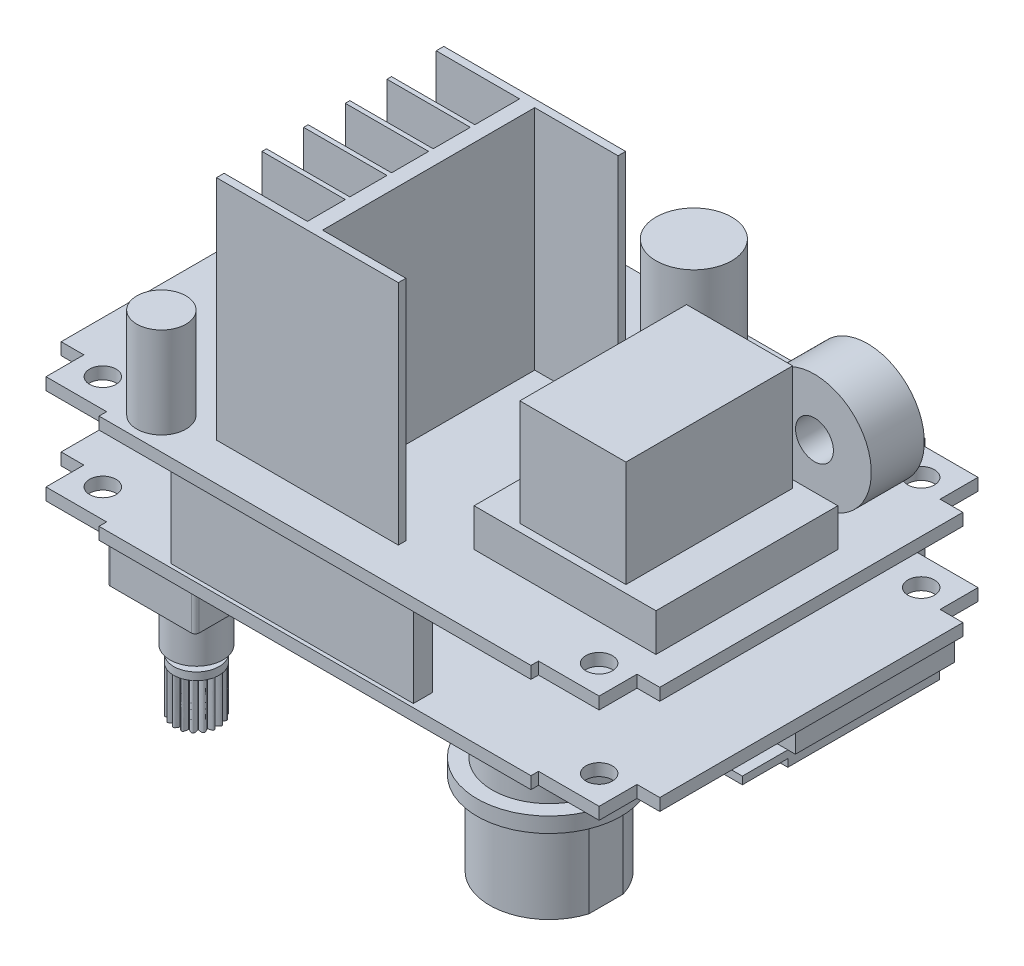
from build123d import *

# Parameters (mm, degrees)
SKETCH_1_R                   = 1.75
EXTRUDE_1_DEPTH              = 1.6
EXTRUDE_2_DEPTH              = 6.5
SKETCH_3_R                   = 3.5
EXTRUDE_3_DEPTH              = 7
SKETCH_4_R                   = 1.50317513
EXTRUDE_4_DEPTH              = 1
SKETCH_5_R                   = 3
EXTRUDE_5_DEPTH              = 1
EXTRUDE_6_DEPTH              = 6
PATTERN_CIRCULAR_2_COUNT     = 18
EXTRUDE_7_DEPTH              = 5
SKETCH_8_R                   = 7.5
EXTRUDE_8_DEPTH              = 4
SKETCH_9_R                   = 9.5
EXTRUDE_9_DEPTH              = 2
SKETCH_10_R                  = 6.35
EXTRUDE_10_DEPTH             = 11
EXTRUDE_11_DEPTH             = 3
SKETCH_12_W                  = 68.5
SKETCH_12_H                  = 26
EXTRUDE_12_DEPTH             = 1
SKETCH_13_W                  = 68.5
SKETCH_13_H                  = 20
EXTRUDE_13_DEPTH             = 1
SKETCH_14_W                  = 51
SKETCH_14_H                  = 2.54
SKETCH_14_W_2                = 32
EXTRUDE_14_DEPTH             = 11
SKETCH_15_R                  = 1.75
EXTRUDE_15_DEPTH             = 1.6
SKETCH_16_R                  = 3.24
EXTRUDE_16_DEPTH             = 12
EXTRUDE_17_DEPTH             = 30
PATTERN_START                = -2.1
PATTERN_LINEAR_1_OUTLINE_W   = 11
PATTERN_LINEAR_1_OUTLINE_H   = 30
PATTERN_LINEAR_1_DEPTH       = 0.6
PATTERN_START_2              = 3.4
PATTERN_LINEAR_1_2_OUTLINE_W = 11
PATTERN_LINEAR_1_2_OUTLINE_H = 30
PATTERN_LINEAR_1_2_DEPTH     = 0.6
PATTERN_START_3              = 8.9
PATTERN_LINEAR_1_3_OUTLINE_W = 11
PATTERN_LINEAR_1_3_OUTLINE_H = 30
PATTERN_LINEAR_1_3_DEPTH     = 0.6
SKETCH_18_R                  = 5
EXTRUDE_18_DEPTH             = 17
SKETCH_19_W                  = 8
SKETCH_19_H                  = 12
EXTRUDE_19_DEPTH             = 3
SKETCH_20_W                  = 1
SKETCH_20_H                  = 9
EXTRUDE_20_DEPTH             = 6
SKETCH_21_W                  = 1
SKETCH_21_H                  = 1
EXTRUDE_21_DEPTH             = 7
SKETCH_22_R                  = 7.5
SKETCH_22_R_2                = 2.5
EXTRUDE_22_DEPTH             = 3.5
SKETCH_23_W                  = 24
SKETCH_23_H                  = 24
EXTRUDE_23_DEPTH             = 5
SKETCH_24_W                  = 14
SKETCH_24_H                  = 22
EXTRUDE_24_DEPTH             = 14


# Read off the part's stored shape, not the designer's step: 阵列(线性)1
with BuildPart() as part:
    # 草图1 → 凸台-拉伸1 (new body)
    with BuildSketch(Plane(origin=(0, 0, 0), x_dir=(1, 0, 0), z_dir=(0, 1, 0))):
        Polygon((39.5, 20), (39.5, -20), (36.5, -20), (36.5, -25), (28.5, -25), (28.5, -26), (-28.5, -26), (-28.5, -25), (-36.5, -25), (-36.5, -20), (-39.5, -20), (-39.5, 20), (-36.5, 20), (-36.5, 25), (-28.5, 25), (-28.5, 26), (28.5, 26), (28.5, 25), (36.5, 25), (36.5, 20), align=None)
        with Locations(Location((32.75, -21.25, 0), (0, 0, 270))):
            Circle(SKETCH_1_R, mode=Mode.SUBTRACT)
        with Locations(Location((-32.75, -21.25, 0), (0, 0, 90))):
            Circle(SKETCH_1_R, mode=Mode.SUBTRACT)
        with Locations(Location((-32.75, 21.25, 0), (0, 0, 270))):
            Circle(SKETCH_1_R, mode=Mode.SUBTRACT)
        with Locations(Location((32.75, 21.25, 0), (0, 0, 90))):
            Circle(SKETCH_1_R, mode=Mode.SUBTRACT)
    extrude(amount=EXTRUDE_1_DEPTH)

    # 草图2 → 凸台-拉伸2 (add)
    with BuildSketch(Plane.XZ):
        with BuildLine():
            Line((-18.3, 12), (-29, 12))
            ThreePointArc((-29, 12), (-29.353553391, 12.146446609), (-29.5, 12.5))
            Line((-29.5, 12.5), (-29.5, 23.5))
            ThreePointArc((-29.5, 23.5), (-29.353553391, 23.853553391), (-29, 24))
            Line((-29, 24), (-18.3, 24))
            ThreePointArc((-18.3, 24), (-17.946446609, 23.853553391), (-17.8, 23.5))
            Line((-17.8, 23.5), (-17.8, 12.5))
            ThreePointArc((-17.8, 12.5), (-17.946446609, 12.146446609), (-18.3, 12))
        make_face()
    extrude(amount=EXTRUDE_2_DEPTH)

    # 草图3 → 凸台-拉伸3 (add)
    with BuildSketch(Plane.XZ.offset(6.5)):
        with Locations(Location((-23.65, 18, 0), (0, 0, 270))):
            Circle(SKETCH_3_R)
    extrude(amount=EXTRUDE_3_DEPTH)

    # 草图4 → 凸台-拉伸4 (add)
    with BuildSketch(Plane.XZ.offset(13.5)):
        with Locations(Location((-23.65, 18, 0), (0, 0, 270))):
            Circle(SKETCH_4_R)
    extrude(amount=EXTRUDE_4_DEPTH)

    # 草图5 → 凸台-拉伸5 (add)
    with BuildSketch(Plane.XZ.offset(14.5)):
        with Locations(Location((-23.65, 18, 0), (0, 0, 270))):
            Circle(SKETCH_5_R)
    extrude(amount=EXTRUDE_5_DEPTH)

    # 草图6 → 凸台-拉伸6 (add)
    with BuildSketch(Plane(origin=(0, -15.5, 0), x_dir=(-1, 0, 0), z_dir=(0, -1, 0))):
        with BuildLine():
            ThreePointArc((23.195961321, -15.541575936), (23.706262098, -20.499366835), (23.992953916, -15.523635202))
            add(Edge.make_bspline(
                [(23.195961321, -15.541575936), (23.545027306, -14.469277331), (23.992953916, -15.523635202)],
                knots=[0, 0, 0, 1, 1, 1], degree=2))
        make_face()
    extrude_6 = extrude(amount=EXTRUDE_6_DEPTH)

    # 阵列(圆周)2: 凸台-拉伸6 ×18 about axis
    pattern_circular_2_axis = Axis((-23.65, -21.5, 18), (0, 1, 0))
    for i in range(1, PATTERN_CIRCULAR_2_COUNT):
        add(extrude_6.rotate(pattern_circular_2_axis, i * 360 / PATTERN_CIRCULAR_2_COUNT))

    # 草图7 → 凸台-拉伸7 (add)
    with BuildSketch(Plane.XZ):
        with BuildLine():
            Line((0.95, 12.75), (-1.261126395, 12.75))
            ThreePointArc((-1.261126395, 12.75), (-10.05, 15.25), (-1.261126395, 17.75))
            Line((-1.261126395, 17.75), (0.95, 17.75))
            Line((0.95, 17.75), (0.95, 12.75))
        make_face()
    extrude(amount=EXTRUDE_7_DEPTH)

    # 草图8 → 凸台-拉伸8 (add)
    with BuildSketch(Plane.XZ):
        with Locations(Location((22, 17.1, 0), (0, 0, 90))):
            Circle(SKETCH_8_R)
    extrude(amount=EXTRUDE_8_DEPTH)

    # 草图9 → 凸台-拉伸9 (add)
    with BuildSketch(Plane.XZ.offset(4)):
        with Locations(Location((22, 17.1, 0), (0, 0, 270))):
            Circle(SKETCH_9_R)
    extrude(amount=EXTRUDE_9_DEPTH)

    # 草图10 → 凸台-拉伸10 (add)
    with BuildSketch(Plane.XZ.offset(6)):
        with BuildLine():
            Line((29.520638271, 14.85), (29.520638271, 19.35))
            ThreePointArc((29.520638271, 19.35), (22, 24.95), (14.479361729, 19.35))
            Line((14.479361729, 19.35), (14.479361729, 14.85))
            ThreePointArc((14.479361729, 14.85), (22, 9.25), (29.520638271, 14.85))
        make_face()
        with Locations(Location((22, 17.1, 0), (0, 0, 270))):
            Circle(SKETCH_10_R, mode=Mode.SUBTRACT)
    extrude(amount=EXTRUDE_10_DEPTH)

    # 草图11 → 凸台-拉伸11 (add)
    with BuildSketch(Plane.XZ):
        Polygon((-31.9, -3.613248654), (-31.9, 1.5), (38.9, 1.5), (38.9, -19.5), (-31.9, -19.5), (-31.9, -14.386751346), (-36.9, -11.5), (-36.9, -6.5), align=None)
    extrude(amount=EXTRUDE_11_DEPTH)

    # 草图12 → 凸台-拉伸12 (add)
    with BuildSketch(Plane(origin=(0, -3, 0), x_dir=(-1, 0, 0), z_dir=(0, -1, 0))):
        with Locations((-3.65, 5.5)):
            Rectangle(SKETCH_12_W, SKETCH_12_H)
    extrude(amount=EXTRUDE_12_DEPTH)

    # 草图13 → 凸台-拉伸13 (add)
    with BuildSketch(Plane.XZ.offset(4)):
        with Locations((3.65, -8.5)):
            Rectangle(SKETCH_13_W, SKETCH_13_H)
    extrude(amount=EXTRUDE_13_DEPTH)

    # 草图14 → 凸台-拉伸14 (add)
    with BuildSketch(Plane(origin=(0, 1.6, 0), x_dir=(1, 0, 0), z_dir=(0, 1, 0))):
        with Locations((-0.117965809, 24.282680859)):
            Rectangle(SKETCH_14_W, SKETCH_14_H)
        with Locations((-3.50214503, -24.242041787)):
            Rectangle(SKETCH_14_W_2, SKETCH_14_H)
    extrude(amount=EXTRUDE_14_DEPTH)

    # 草图15 → 凸台-拉伸15 (add)
    with BuildSketch(Plane(origin=(0, 12.6, 0), x_dir=(1, 0, 0), z_dir=(0, 1, 0))):
        Polygon((28.5, -25), (36.5, -25), (36.5, -20), (39.5, -20), (39.5, 20), (36.5, 20), (36.5, 25), (28.5, 25), (28.5, 26), (-28.5, 26), (-28.5, 25), (-36.5, 25), (-36.5, 20), (-39.5, 20), (-39.5, -20), (-36.5, -20), (-36.5, -25), (-28.5, -25), (-28.5, -26), (28.5, -26), align=None)
        with Locations(Location((-32.75, -21.25, 0), (0, 0, 90))):
            Circle(SKETCH_15_R, mode=Mode.SUBTRACT)
        with Locations(Location((32.75, -21.25, 0), (0, 0, 270))):
            Circle(SKETCH_15_R, mode=Mode.SUBTRACT)
        with Locations(Location((32.75, 21.25, 0), (0, 0, 90))):
            Circle(SKETCH_15_R, mode=Mode.SUBTRACT)
        with Locations(Location((-32.75, 21.25, 0), (0, 0, 270))):
            Circle(SKETCH_15_R, mode=Mode.SUBTRACT)
    extrude(amount=EXTRUDE_15_DEPTH)

    # 草图16 → 凸台-拉伸16 (add)
    with BuildSketch(Plane(origin=(0, 14.2, 0), x_dir=(1, 0, 0), z_dir=(0, 1, 0))):
        with Locations(Location((-24.51, -21.76, 0), (0, 0, 90))):
            Circle(SKETCH_16_R)
        with Locations(Location((-24.51, -3.76, 0), (0, 0, 90))):
            Circle(SKETCH_16_R)
    extrude(amount=EXTRUDE_16_DEPTH)

    # 草图17 → 凸台-拉伸17 (add)
    with BuildSketch(Plane(origin=(0, 14.2, 0), x_dir=(1, 0, 0), z_dir=(0, 1, 0))):
        Polygon((-18, -20), (-18, -21), (-7, -21), (-5, -21), (6, -21), (6, -20), (-5, -20), (-5, 8), (6, 8), (6, 9), (-5, 9), (-7, 9), (-18, 9), (-18, 8), (-7, 8), (-7, -14.4), (-18, -14.4), (-18, -15), (-7, -15), (-7, -20), align=None)
    extrude(amount=EXTRUDE_17_DEPTH)

    # 阵列(线性)1 outline → 阵列(线性)1 (add)
    with BuildSketch(Plane.XY.offset(PATTERN_START)):
        with Locations((-12.5, 29.2)):
            Rectangle(PATTERN_LINEAR_1_OUTLINE_W, PATTERN_LINEAR_1_OUTLINE_H)
    extrude(amount=PATTERN_LINEAR_1_DEPTH)

    # Pattern Linear 1 2 outline → Pattern Linear 1 2 (add)
    with BuildSketch(Plane.XY.offset(PATTERN_START_2)):
        with Locations((-12.5, 29.2)):
            Rectangle(PATTERN_LINEAR_1_2_OUTLINE_W, PATTERN_LINEAR_1_2_OUTLINE_H)
    extrude(amount=PATTERN_LINEAR_1_2_DEPTH)

    # Pattern Linear 1 3 outline → Pattern Linear 1 3 (add)
    with BuildSketch(Plane.XY.offset(PATTERN_START_3)):
        with Locations((-12.5, 29.2)):
            Rectangle(PATTERN_LINEAR_1_3_OUTLINE_W, PATTERN_LINEAR_1_3_OUTLINE_H)
    extrude(amount=PATTERN_LINEAR_1_3_DEPTH)

    # 草图18 → 凸台-拉伸18 (add)
    with BuildSketch(Plane(origin=(0, 14.2, 0), x_dir=(1, 0, 0), z_dir=(0, 1, 0))):
        with Locations(Location((7.5, 16.5, 0), (0, 0, 90))):
            Circle(SKETCH_18_R)
        with Locations(Location((-10.5, 16.5, 0), (0, 0, 90))):
            Circle(SKETCH_18_R)
    extrude(amount=EXTRUDE_18_DEPTH)

    # 草图19 → 凸台-拉伸19 (add)
    with BuildSketch(Plane(origin=(0, 14.2, 0), x_dir=(1, 0, 0), z_dir=(0, 1, 0))):
        with Locations((-20, 16)):
            Rectangle(SKETCH_19_W, SKETCH_19_H)
    extrude(amount=EXTRUDE_19_DEPTH)

    # 草图20 → 凸台-拉伸20 (add)
    with BuildSketch(Plane(origin=(0, 17.2, 0), x_dir=(1, 0, 0), z_dir=(0, 1, 0))):
        with Locations((-23.5, 16.045618219)):
            Rectangle(SKETCH_20_W, SKETCH_20_H)
    extrude(amount=EXTRUDE_20_DEPTH)

    # 草图21 → 凸台-拉伸21 (add)
    with BuildSketch(Plane(origin=(0, 17.2, 0), x_dir=(1, 0, 0), z_dir=(0, 1, 0))):
        with Locations((-21, 16)):
            Rectangle(SKETCH_21_W, SKETCH_21_H)
        with Locations((-21, 12.06)):
            Rectangle(SKETCH_21_W, SKETCH_21_H)
        with Locations((-21, 19.94)):
            Rectangle(SKETCH_21_W, SKETCH_21_H)
    extrude(amount=EXTRUDE_21_DEPTH)

    # 草图23 → 凸台-拉伸23 (add)
    with BuildSketch(Plane(origin=(0, 14.2, 0), x_dir=(1, 0, 0), z_dir=(0, 1, 0))):
        with Locations((23.5, -4.5)):
            Rectangle(SKETCH_23_W, SKETCH_23_H)
    extrude(amount=EXTRUDE_23_DEPTH)

    # 草图24 → 凸台-拉伸24 (add)
    with BuildSketch(Plane(origin=(0, 19.2, 0), x_dir=(1, 0, 0), z_dir=(0, 1, 0))):
        with Locations((23.525152897, -4.488451989)):
            Rectangle(SKETCH_24_W, SKETCH_24_H)
    extrude(amount=EXTRUDE_24_DEPTH)


with BuildPart() as body_2:
    # 草图22 → 凸台-拉伸22 (new, symmetric)
    with BuildSketch(Plane(origin=(0, 0, -14.5), x_dir=(-1, 0, 0), z_dir=(0, 0, -1))):
        with Locations((-28.9195249, 21.7)):
            Circle(SKETCH_22_R)
        with Locations((-28.9195249, 21.7)):
            Circle(SKETCH_22_R_2, mode=Mode.SUBTRACT)
    extrude(amount=EXTRUDE_22_DEPTH, both=True)


solid = Compound([part.part, body_2.part])
